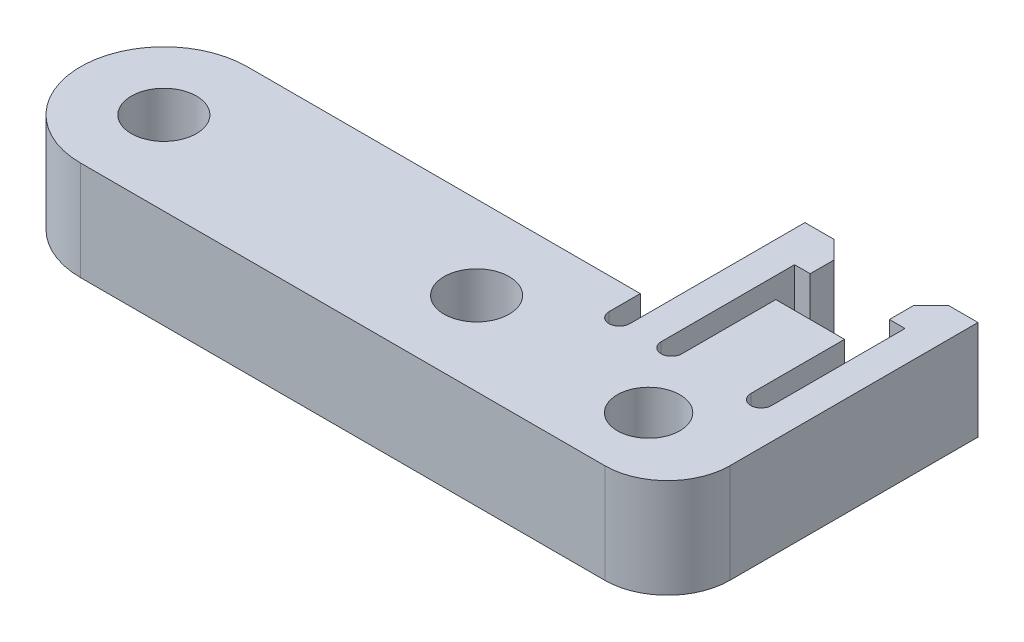
from build123d import *

# Parameters (mm, degrees)
SKETCH1_R           = 1.5625
BOSS_EXTRUDE1_DEPTH = 4.7625
FILLET1_R           = 0.5
SKETCH2_R           = 1.5
CUT_EXTRUDE1_DEPTH  = 31.457862798


with BuildPart() as part:
    # Sketch1 → Boss-Extrude1 (new body)
    with BuildSketch(Plane(origin=(0, 0, 0), x_dir=(1, 0, 0), z_dir=(0, 1, 0))):
        with BuildLine():
            Line((-1.65, 0), (1.65, 0))
            Line((1.65, 0), (1.65, -5))
            Line((1.65, -5), (2.65, -5))
            Line((2.65, -5), (2.65, 1.9))
            Line((2.65, 1.9), (1.9, 1.9))
            Line((1.9, 1.9), (1.9, 3.05))
            Line((1.9, 3.05), (2.75, 3.9))
            Line((2.75, 3.9), (4.15, 3.9))
            Line((4.15, 3.9), (4.15, -8))
            ThreePointArc((4.15, -8), (3.271320344, -10.121320344), (1.15, -11))
            Line((1.15, -11), (-24, -11))
            ThreePointArc((-24, -11), (-28, -7), (-24, -3))
            Line((-24, -3), (-5.15, -3))
            Line((-5.15, -3), (-5.15, -5))
            Line((-5.15, -5), (-4.15, -5))
            Line((-4.15, -5), (-4.15, 3.9))
            Line((-4.15, 3.9), (-2.75, 3.9))
            Line((-2.75, 3.9), (-1.9, 3.05))
            Line((-1.9, 3.05), (-1.9, 1.9))
            Line((-1.9, 1.9), (-2.65, 1.9))
            Line((-2.65, 1.9), (-2.65, -5))
            Line((-2.65, -5), (-1.65, -5))
            Line((-1.65, -5), (-1.65, 0))
        make_face()
        with Locations(Location((-24, -7, 0), (0, 0, 90))):
            Circle(SKETCH1_R, mode=Mode.SUBTRACT)
        with Locations(Location((-9, -7, 0), (0, 0, 90))):
            Circle(SKETCH1_R, mode=Mode.SUBTRACT)
    extrude(amount=BOSS_EXTRUDE1_DEPTH)

    # Fillet1
    fillet1_edges = [part.edges().sort_by_distance(p)[0] for p in [
        (-2.65, 2.38125, 5),
        (-1.65, 2.38125, 5),
        (2.65, 2.38125, 5),
        (1.65, 2.38125, 5),
        (-5.15, 2.38125, 5),
        (-4.15, 2.38125, 5),
    ]]
    fillet(fillet1_edges, radius=FILLET1_R - 0.0001)  # a hair under: the kernel refuses the full size

    # Sketch2 → Cut-Extrude1 (cut, through all)
    with BuildSketch(Plane(origin=(0, 4.7625, 0), x_dir=(1, 0, 0), z_dir=(0, 1, 0))):
        with Locations(Location((0, -7.75, 0), (0, 0, 270))):
            Circle(SKETCH2_R)
    extrude(amount=-CUT_EXTRUDE1_DEPTH, mode=Mode.SUBTRACT)


solid = part.part
